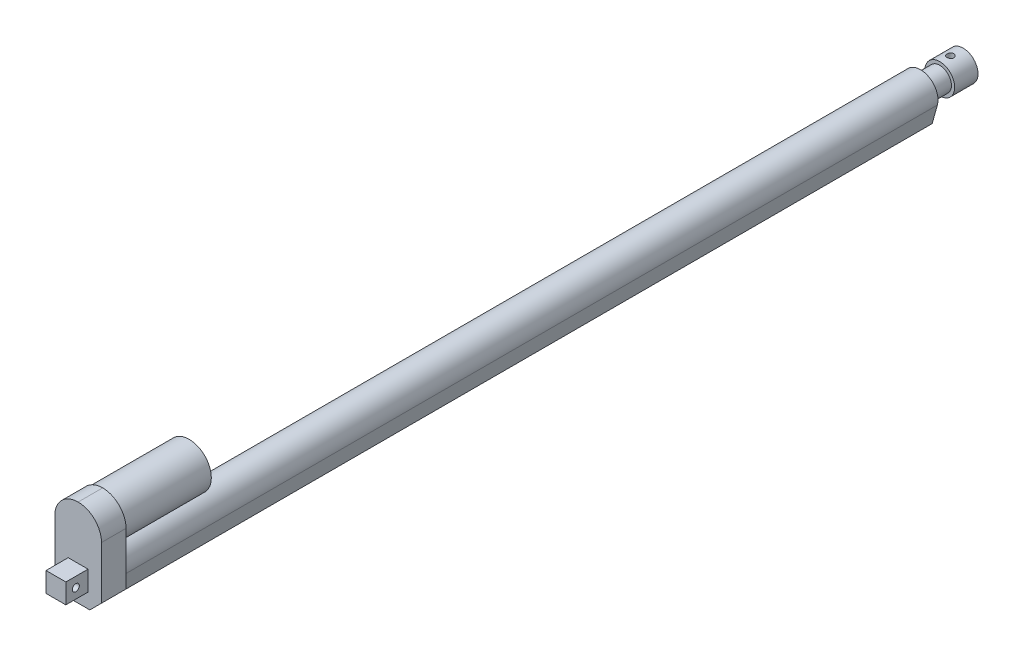
from build123d import *

# Parameters (mm, degrees)
SKETCH_1_W          = 40
SKETCH_1_H          = 75
EXTRUDE_1_DEPTH     = 21
FILLET_1_R          = 20
CHAMFER_1_SIZE      = 10
EXTRUDE_2_DEPTH     = 700
SKETCH_3_R          = 19
EXTRUDE_4_DEPTH     = 74
SKETCH_4_W          = 17
SKETCH_4_H          = 17
EXTRUDE_5_DEPTH     = 19
SKETCH_5_R          = 3
CUT_EXTRUDE_1_DEPTH = 19
SKETCH_6_R          = 10
EXTRUDE_6_DEPTH     = 16.5
SKETCH_7_R          = 12.75
EXTRUDE_7_DEPTH     = 20
SKETCH_9_R          = 2.9
CUT_EXTRUDE_2_DEPTH = 741.578996462


with BuildPart() as part:
    # 草图1 → 凸台-拉伸1 (new body)
    with BuildSketch(Plane.XY):
        Rectangle(SKETCH_1_W, SKETCH_1_H)
    extrude(amount=EXTRUDE_1_DEPTH)

    # 圆角1
    fillet_1_edges = [part.edges().sort_by_distance(p)[0] for p in [
        (-20, 37.5, 10.5),
        (20, 37.5, 10.5),
    ]]
    fillet(fillet_1_edges, radius=FILLET_1_R - 0.0001)  # a hair under: the kernel refuses the full size

    # 倒角1
    chamfer_1_edges = [part.edges().sort_by_distance(p)[0] for p in [
        (20, -37.5, 10.5),
        (-20, -37.5, 10.5),
    ]]
    chamfer(chamfer_1_edges, length=CHAMFER_1_SIZE)

    # 草图2 → 凸台-拉伸2 (add)
    with BuildSketch(Plane(origin=(0, 0, 0), x_dir=(-1, 0, 0), z_dir=(0, 0, -1))):
        with BuildLine():
            Line((-10, -37.5), (10, -37.5))
            Line((10, -37.5), (14.449874371, -21.525062814))
            ThreePointArc((14.449874371, -21.525062814), (0, -2.5), (-14.449874371, -21.525062814))
            Line((-14.449874371, -21.525062814), (-10, -37.5))
        make_face()
    extrude(amount=EXTRUDE_2_DEPTH)

    # 草图3 → 凸台-拉伸4 (add)
    with BuildSketch(Plane(origin=(0, 0, 0), x_dir=(-1, 0, 0), z_dir=(0, 0, -1))):
        with Locations(Location((0, 17.5, 0), (0, 0, 180))):
            Circle(SKETCH_3_R)
    extrude(amount=EXTRUDE_4_DEPTH)

    # 草图4 → 凸台-拉伸5 (add)
    with BuildSketch(Plane.XY.offset(21)):
        with Locations((0, -16.5)):
            Rectangle(SKETCH_4_W, SKETCH_4_H)
    extrude(amount=EXTRUDE_5_DEPTH)

    # 草图5 → 切除-拉伸1 (cut)
    with BuildSketch(Plane.ZY.offset(8.5)):
        with Locations(Location((31.5, -16.5, 0), (0, 0, 270))):
            Circle(SKETCH_5_R)
    extrude(amount=-CUT_EXTRUDE_1_DEPTH, mode=Mode.SUBTRACT)

    # 草图6 → 凸台-拉伸6 (add)
    with BuildSketch(Plane(origin=(0, 0, -700), x_dir=(-1, 0, 0), z_dir=(0, 0, -1))):
        with Locations((0, -17.5)):
            Circle(SKETCH_6_R)
    extrude(amount=EXTRUDE_6_DEPTH)

    # 草图7 → 凸台-拉伸7 (add)
    with BuildSketch(Plane(origin=(0, 0, -716.5), x_dir=(-1, 0, 0), z_dir=(0, 0, -1))):
        with Locations((0, -17.5)):
            Circle(SKETCH_7_R)
    extrude(amount=EXTRUDE_7_DEPTH)

    # 草图9 → 切除-拉伸2 (cut, through all)
    with BuildSketch(Plane.XZ.offset(37.5)):
        with Locations((0, -725.5)):
            Circle(SKETCH_9_R)
    extrude(amount=-CUT_EXTRUDE_2_DEPTH, mode=Mode.SUBTRACT)


solid = part.part
